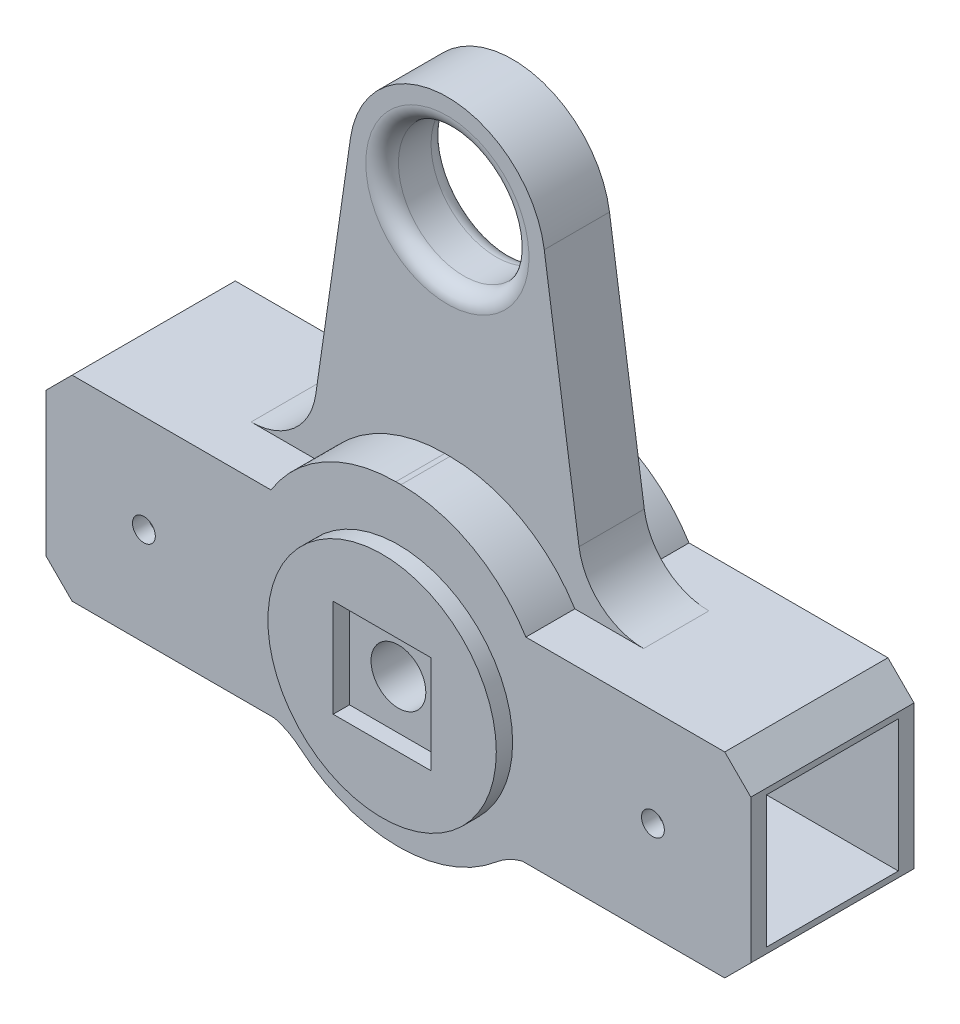
from build123d import *

# Parameters (mm, degrees)
CROQUIS1_R                   = 15
CROQUIS1_R_2                 = 10
SALIENTE_EXTRUIR1_DEPTH      = 12.5
CORTAR_EXTRUIR2_DEPTH        = 78.778499901
CORTAR_EXTRUIR2_DEPTH_BACK   = 78.778499901
CROQUIS3_W                   = 7.5
CROQUIS3_H                   = 47.5
REDONDEO3_R                  = 22.5
CROQUIS4_W                   = 35
CROQUIS4_H                   = 30
CROQUIS4_R                   = 1.75
SALIENTE_EXTRUIR2_DEPTH      = 25
CROQUIS5_W                   = 20.2
CROQUIS5_H                   = 20.2
CORTAR_EXTRUIR3_DEPTH        = 30
REDONDEO4_R                  = 10
CHAFL_N1_SIZE                = 4
REDONDEO6_R                  = 2.5
SALIENTE_EXTRUIR3_DEPTH      = 2.5
SALIENTE_EXTRUIR3_DEPTH_BACK = 27.5
CROQUIS6_R                   = 17.5
CROQUIS6_R_2                 = 11.1
CROQUIS8_R                   = 17.5
CROQUIS8_R_2                 = 4.2
SALIENTE_EXTRUIR4_DEPTH      = 20
CORTAR_EXTRUIR4_DEPTH        = 96.753237788
CORTAR_EXTRUIR4_DEPTH_BACK   = 2.5
CROQUIS9_W                   = 15
CROQUIS9_H                   = 15
CROQUIS9_R                   = 4.2


with BuildPart() as part:
    # Croquis1 → Saliente-Extruir1 (new, symmetric)
    with BuildSketch(Plane.XY):
        with BuildLine():
            Line((-23.009443154, 3.997898972), (-14.844802035, 60.31420332))
            ThreePointArc((-14.844802035, 60.31420332), (0, 73.162029407), (14.844802035, 60.31420332))
            Line((14.844802035, 60.31420332), (23.009443154, 3.997898972))
            ThreePointArc((23.009443154, 3.997898972), (0, -22.587970593), (-23.009443154, 3.997898972))
        make_face()
        Circle(CROQUIS1_R, mode=Mode.SUBTRACT)
        with Locations((0, 58.162029407)):
            Circle(CROQUIS1_R_2, mode=Mode.SUBTRACT)
    extrude(amount=SALIENTE_EXTRUIR1_DEPTH, both=True)

    # Croquis3 → Cortar-Extruir2 (cut, two sides: drawn at the far end of the back side and taken through both)
    with BuildSketch(Plane(origin=(0, 0, 0), x_dir=(0, 0, -1), z_dir=(1, 0, 0)).offset(-CORTAR_EXTRUIR2_DEPTH_BACK)):
        with Locations((8.75, 49.412029407)):
            Rectangle(CROQUIS3_W, CROQUIS3_H)
        with Locations((-8.75, 49.412029407)):
            Rectangle(CROQUIS3_W, CROQUIS3_H)
    extrude(amount=CORTAR_EXTRUIR2_DEPTH + CORTAR_EXTRUIR2_DEPTH_BACK, mode=Mode.SUBTRACT)

    # Redondeo3
    redondeo3_edges = [part.edges().sort_by_distance(p)[0] for p in [
        (-19.868614717, 25.662029407, 8.75),
        (-19.868614717, 25.662029407, -8.75),
        (19.868614717, 25.662029407, -8.75),
        (19.868614717, 25.662029407, 8.75),
    ]]
    fillet(redondeo3_edges, radius=REDONDEO3_R)

    # Croquis4 → Saliente-Extruir2 (add)
    # profile 1 of 2: a face of its own
    with BuildSketch(Plane(origin=(0, 0, -12.5), x_dir=(-1, 0, 0), z_dir=(0, 0, -1))):
        with Locations((-36.5, 0)):
            Rectangle(CROQUIS4_W, CROQUIS4_H)
        with Locations((-39, 0)):
            Circle(CROQUIS4_R, mode=Mode.SUBTRACT)
    # profile 2 of 2: a face of its own
    with BuildSketch(Plane(origin=(0, 0, -12.5), x_dir=(-1, 0, 0), z_dir=(0, 0, -1))):
        with Locations((36.5, 0)):
            Rectangle(CROQUIS4_W, CROQUIS4_H)
        with Locations(Location((39, 0, 0), (0, 0, 180))):
            Circle(CROQUIS4_R, mode=Mode.SUBTRACT)
    extrude(amount=-SALIENTE_EXTRUIR2_DEPTH)

    # Croquis5 → Cortar-Extruir3 (cut)
    with BuildSketch(Plane(origin=(54, 0, 0), x_dir=(0, 0, -1), z_dir=(1, 0, 0))):
        Rectangle(CROQUIS5_W, CROQUIS5_H)
    cortar_extruir3 = extrude(amount=-CORTAR_EXTRUIR3_DEPTH, mode=Mode.SUBTRACT)

    # Simetría1: Cortar-Extruir3 across plane
    add(cortar_extruir3.mirror(Plane(origin=(0, 0, 0), x_dir=(0, 0, 1), z_dir=(1, 0, 0))), mode=Mode.SUBTRACT)

    # Redondeo4
    # the kernel refuses this fillet: 10 mm, written as the material it adds along each edge
    with BuildSketch(Plane(origin=(-19, -12.738063876, -12.5), x_dir=(0.674519649650932, -0.7382568944715545, 0), z_dir=(0, 0, 1))) as redondeo4_piece_1:
        with BuildLine():
            CenterArc((7.103598198, -9.920648267), REDONDEO4_R, 97.222764243, 25.690637502)
            Line((1.669889938, -1.525720362), (0, 0))
            ThreePointArc((0, 0), (2.92316209, -0.184492778), (5.846324181, 0))
        make_face()
    extrude(amount=25)
    with BuildSketch(Plane(origin=(19, -12.738063876, -12.5), x_dir=(0, -1, 0), z_dir=(0, 0, 1))) as redondeo4_piece_2:
        with BuildLine():
            CenterArc((11.935952539, 2.532470413), REDONDEO4_R, 194.669738911, 25.690637502)
            ThreePointArc((4.316089134, -3.943460538), (2.282488571, -1.835527204), (0, 0))
            Line((0, 0), (2.261936124, 0))
        make_face()
    extrude(amount=25)
    with BuildSketch(Plane(origin=(21.414377435, 15, -5), x_dir=(1, 0, 0), z_dir=(0, 0, 1)), Plane(origin=(-21.414377435, 15, 5), x_dir=(-1, 0, 0), z_dir=(0, 0, -1))) as redondeo4_piece_3:
        with BuildLine():
            CenterArc((REDONDEO4_R * 0.865476417736, REDONDEO4_R), REDONDEO4_R, 188.249168565, 81.750831435)
            Line((-REDONDEO4_R * 0.12417705124, REDONDEO4_R * 0.85652173913), (0, 0))
            Line((0, 0), (REDONDEO4_R * 0.865476417736, 0))
        make_face()
    extrude(amount=10)

    # Chaflán1
    chafl_n1_edges = [part.edges().sort_by_distance(p)[0] for p in [
        (-54, 15, 0),
        (-54, -15, 0),
        (54, -15, 0),
        (54, 15, 0),
    ]]
    chamfer(chafl_n1_edges, length=CHAFL_N1_SIZE)

    # Redondeo6
    redondeo6_edges = [part.edges().sort_by_distance(p)[0] for p in [
        (-10, 58.162029407, -5),
        (-10, 58.162029407, 5),
    ]]
    fillet(redondeo6_edges, radius=REDONDEO6_R)

    # Croquis6 → Saliente-Extruir3 (add, two sides: drawn at the far end of the back side and taken through both)
    with BuildSketch(Plane.XY.offset(12.5).offset(-SALIENTE_EXTRUIR3_DEPTH_BACK)):
        Circle(CROQUIS6_R)
        Circle(CROQUIS6_R_2, mode=Mode.SUBTRACT)
    extrude(amount=SALIENTE_EXTRUIR3_DEPTH + SALIENTE_EXTRUIR3_DEPTH_BACK)

    # Croquis8 → Saliente-Extruir4 (add)
    with BuildSketch(Plane.XY.offset(15)):
        Circle(CROQUIS8_R)
        Circle(CROQUIS8_R_2, mode=Mode.SUBTRACT)
    extrude(amount=-SALIENTE_EXTRUIR4_DEPTH)

    # Croquis9 → Cortar-Extruir4 (cut, two sides: drawn at the far end of the back side and taken through both)
    with BuildSketch(Plane.XY.offset(15).offset(-CORTAR_EXTRUIR4_DEPTH_BACK)):
        Rectangle(CROQUIS9_W, CROQUIS9_H)
        Circle(CROQUIS9_R, mode=Mode.SUBTRACT)
    extrude(amount=CORTAR_EXTRUIR4_DEPTH + CORTAR_EXTRUIR4_DEPTH_BACK, mode=Mode.SUBTRACT)


solid = part.part
